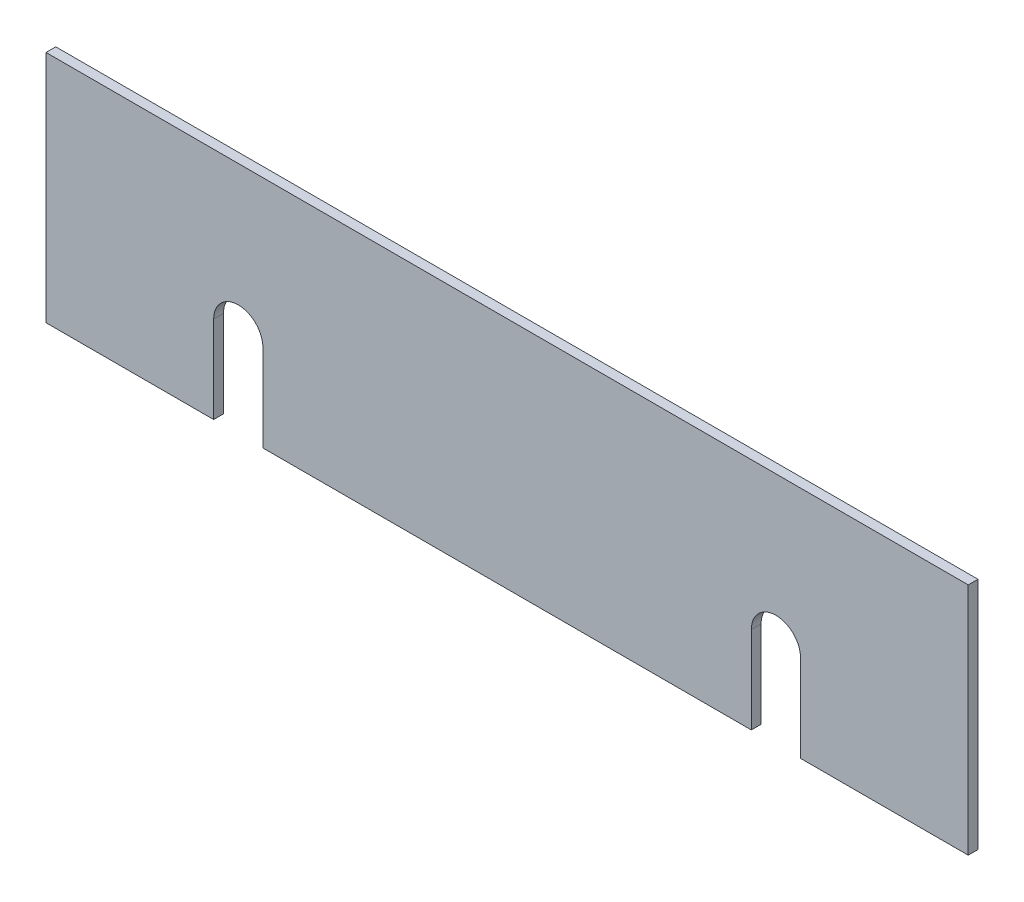
from build123d import *

# Parameters (mm, degrees)
SKETCH1_W           = 299.7
SKETCH1_H           = 76.075
BOSS_EXTRUDE1_DEPTH = 3.175
CUT_EXTRUDE1_DEPTH  = 155.634907221


with BuildPart() as part:
    # Sketch1 → Boss-Extrude1 (new body)
    with BuildSketch(Plane.XY):
        Rectangle(SKETCH1_W, SKETCH1_H)
    extrude(amount=BOSS_EXTRUDE1_DEPTH)

    # Sketch3 → Cut-Extrude1 (cut, through all)
    with BuildSketch(Plane(origin=(0, 0, 0), x_dir=(-1, 0, 0), z_dir=(0, 0, -1))):
        with BuildLine():
            Line((-95.365066213, -38.0375), (-79.365066213, -38.0375))
            Line((-79.365066213, -38.0375), (-79.365066213, -9.7625))
            ThreePointArc((-79.365066213, -9.7625), (-87.365066213, -1.7625), (-95.365066213, -9.7625))
            Line((-95.365066213, -9.7625), (-95.365066213, -38.0375))
        make_face()
        with BuildLine():
            ThreePointArc((95.365066213, -9.7625), (87.365066213, -1.7625), (79.365066213, -9.7625))
            Line((79.365066213, -9.7625), (79.365066213, -38.0375))
            Line((79.365066213, -38.0375), (95.365066213, -38.0375))
            Line((95.365066213, -38.0375), (95.365066213, -9.7625))
        make_face()
    extrude(amount=-CUT_EXTRUDE1_DEPTH, mode=Mode.SUBTRACT)


solid = part.part
